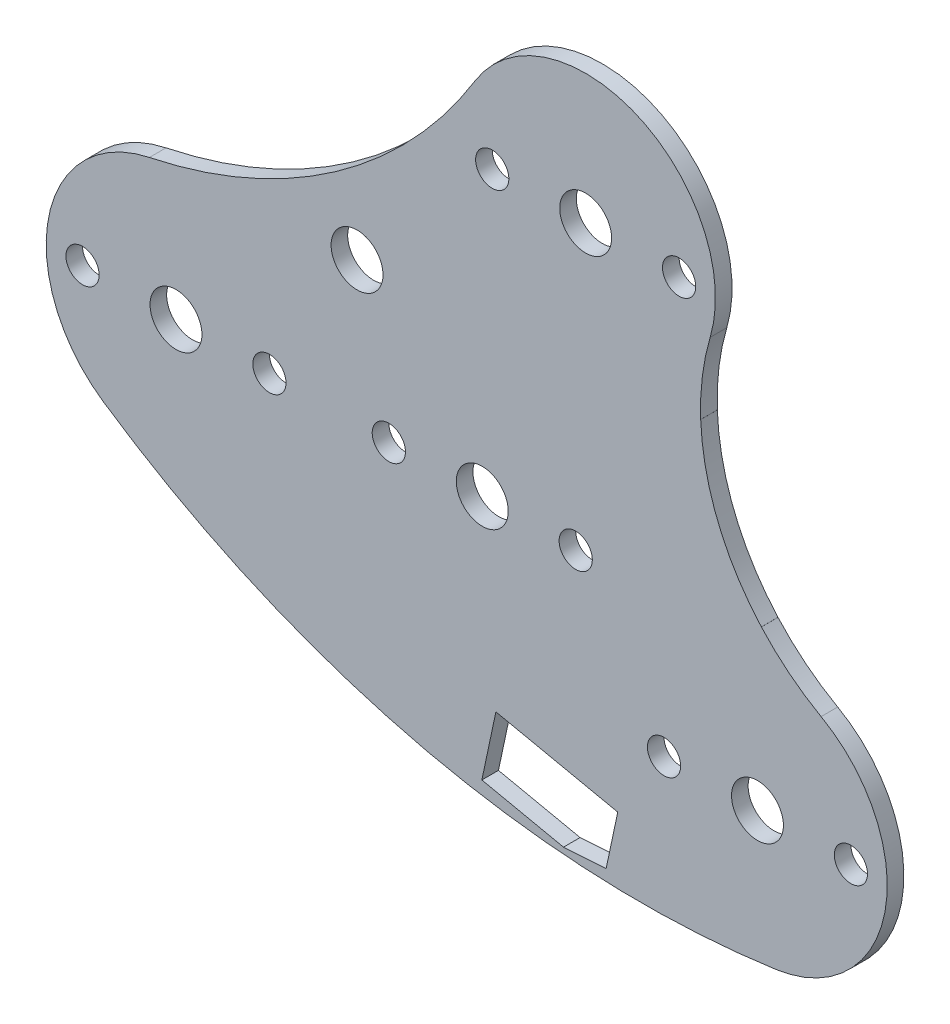
from build123d import *

# Parameters (mm, degrees)
BOSS_EXTRUDE1_DEPTH = 1.6
SKETCH8_3_R         = 2.5
CUT_EXTRUDE1_DEPTH  = 178.756608161
SKETCH25_R          = 2.5
CUT_EXTRUDE2_DEPTH  = 178.756608161
SKETCH16_R          = 1.6
CUT_EXTRUDE3_DEPTH  = 178.756608161
CUT_EXTRUDE6_DEPTH  = 175.275284078


with BuildPart() as part:
    # Sketch8 → Boss-Extrude1 (new body)
    with BuildSketch(Plane.XY):
        with BuildLine():
            ThreePointArc((76.976923111, 65.600382715), (77.137220348, 65.563882378), (77.2977589, 65.528458486))
            ThreePointArc((77.2977589, 65.528458486), (77.354298773, 65.515492739), (77.410522602, 65.501218676))
            ThreePointArc((77.410522602, 65.501218676), (94.023303804, 63.303193357), (110.759742778, 64.144278965))
            ThreePointArc((110.759742778, 64.144278965), (121.287127646, 74.212620667), (115.130462452, 87.414620912))
            ThreePointArc((115.130462452, 87.414620912), (112.067901623, 89.481121015), (109.379631064, 92.015465685))
            ThreePointArc((109.379631064, 92.015465685), (109.377986421, 92.015505684), (109.376341775, 92.015545509))
            ThreePointArc((109.376341775, 92.015545509), (109.37615287, 92.017539878), (109.375963817, 92.019534234))
            ThreePointArc((109.375963817, 92.019534234), (105.194093866, 98.693961054), (103.534911629, 106.393514545))
            ThreePointArc((103.534911629, 106.393514545), (103.533655951, 106.395075463), (103.532400156, 106.396636288))
            ThreePointArc((103.532400156, 106.396636288), (103.533550841, 106.397812032), (103.534701401, 106.398987898))
            ThreePointArc((103.534701401, 106.398987898), (103.693161759, 110.090138371), (104.446158593, 113.707139515))
            ThreePointArc((104.446158593, 113.707139515), (97.535722451, 128.659745128), (81.803110207, 123.779227301))
            ThreePointArc((81.803110207, 123.779227301), (68.396685685, 109.506582784), (50.436082024, 101.705472858))
            ThreePointArc((50.436082024, 101.705472858), (40.732585656, 91.888172428), (45.984244445, 79.122699094))
            ThreePointArc((45.984244445, 79.122699094), (60.856228216, 70.93053968), (76.976923111, 65.600382715))
        make_face()
    extrude(amount=BOSS_EXTRUDE1_DEPTH)

    # Sketch8<3> → Cut-Extrude1 (cut, through all)
    with BuildSketch(Plane.XY):
        with Locations((70.435309654, 103.157249982)):
            Circle(SKETCH8_3_R)
    extrude(amount=CUT_EXTRUDE1_DEPTH, mode=Mode.SUBTRACT)

    # Sketch25 → Cut-Extrude2 (cut, through all)
    with BuildSketch(Plane.XY):
        with Locations((52.996556322, 89.470524089)):
            Circle(SKETCH25_R)
        with Locations((82.496556322, 89.470524089)):
            Circle(SKETCH25_R)
        with Locations((92.45540719, 117.238694526)):
            Circle(SKETCH25_R)
        with Locations((109.001946024, 76.520067852)):
            Circle(SKETCH25_R)
    extrude(amount=CUT_EXTRUDE2_DEPTH, mode=Mode.SUBTRACT)

    # Sketch16 → Cut-Extrude3 (cut, through all)
    with BuildSketch(Plane.XY):
        with Locations((43.996556322, 89.470524089)):
            Circle(SKETCH16_R)
        with Locations((61.996556322, 89.470524089)):
            Circle(SKETCH16_R)
        with Locations((73.496556322, 89.470524089)):
            Circle(SKETCH16_R)
        with Locations((91.496556322, 89.470524089)):
            Circle(SKETCH16_R)
        with Locations((100.001946024, 76.520067852)):
            Circle(SKETCH16_R)
        with Locations((118.001946024, 76.520067852)):
            Circle(SKETCH16_R)
        with Locations((83.45540719, 117.238694526)):
            Circle(SKETCH16_R)
        with Locations((101.45540719, 117.238694526)):
            Circle(SKETCH16_R)
    extrude(amount=CUT_EXTRUDE3_DEPTH, mode=Mode.SUBTRACT)

    # Sketch23 → Cut-Extrude6 (cut, through all)
    with BuildSketch(Plane(origin=(-19.097367964, 26.776820286, 0), x_dir=(0.9781476007338056, -0.2079116908177598, 0), z_dir=(0, 0, 1))):
        Polygon((103.223291241, 65.776224437), (91.223291241, 65.776224437), (91.223291241, 59.276224437), (99.26102874, 59.276224437), (103.223291241, 60.39602146), align=None)
    extrude(amount=CUT_EXTRUDE6_DEPTH, mode=Mode.SUBTRACT)


solid = part.part
